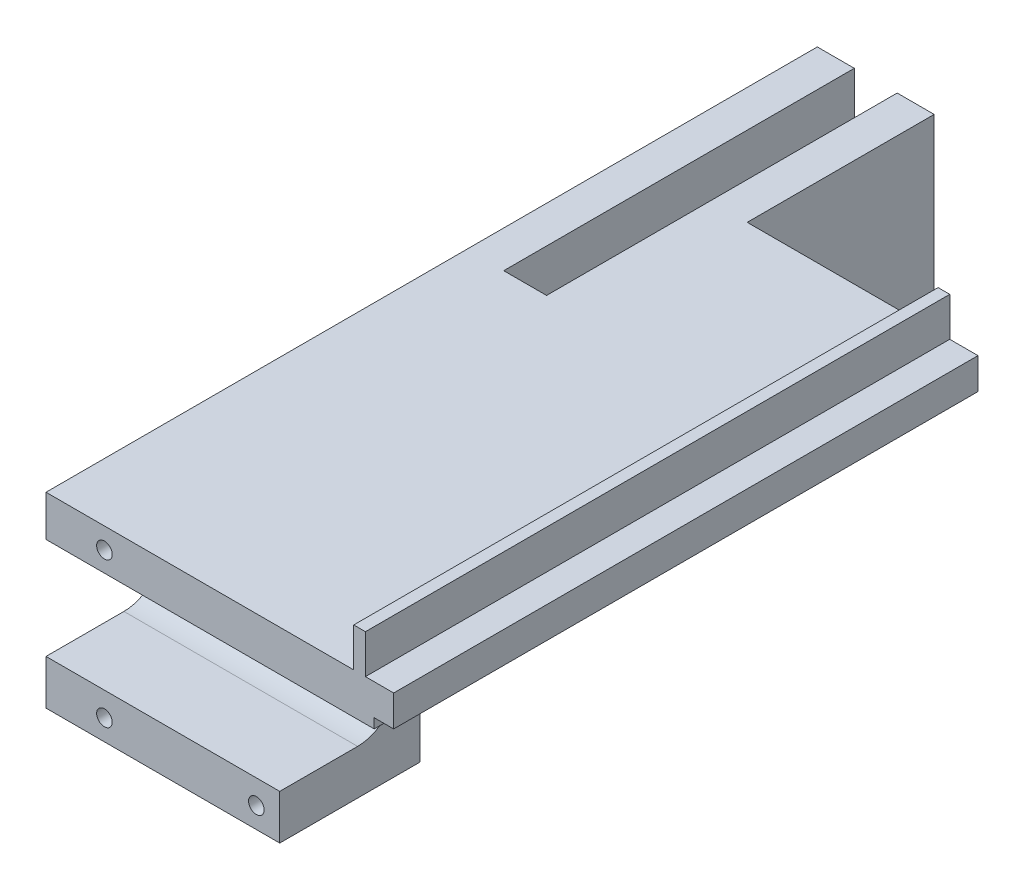
from build123d import *

# Parameters (mm, degrees)
CROQUIS1_W                 = 60
CROQUIS1_H                 = 48
SALIENTE_EXTRUIR1_DEPTH    = 6
CROQUIS4_W                 = 60
CROQUIS4_H                 = 11.5
SALIENTE_EXTRUIR3_DEPTH    = 30
CROQUIS5_R                 = 2
CORTAR_EXTRUIR3_DEPTH      = 16
CROQUIS6_W                 = 30
CROQUIS6_H                 = 48
SALIENTE_EXTRUIR4_DEPTH    = 162
CROQUIS7_R                 = 2
CORTAR_EXTRUIR4_DEPTH      = 16
CROQUIS11_W                = 150
CROQUIS11_H                = 11.5
SALIENTE_EXTRUIR6_DEPTH    = 59.25
CROQUIS12_W                = 3
CROQUIS12_H                = 150
SALIENTE_EXTRUIR7_DEPTH    = 10
CORTAR_EXTRUIR6_DEPTH      = 170.016303475
CORTAR_EXTRUIR6_DEPTH_BACK = 170.016303475
CROQUIS14_W                = 5
CROQUIS14_H                = 3.5
CORTAR_EXTRUIR7_DEPTH      = 213.768679181
CORTAR_EXTRUIR7_DEPTH_BACK = 90
CROQUIS15_W                = 11
CROQUIS15_H                = 11
CROQUIS16_W                = 30
CROQUIS16_H                = 1
CORTAR_EXTRUIR10_DEPTH     = 190.450484429
REDONDEO1_R                = 10


with BuildPart() as part:
    # Croquis1 → Saliente-Extruir1 (new body)
    with BuildSketch(Plane.XY):
        with Locations((-36.216216216, 7.011261261)):
            Rectangle(CROQUIS1_W, CROQUIS1_H)
    extrude(amount=SALIENTE_EXTRUIR1_DEPTH)

    # Croquis4 → Saliente-Extruir3 (add)
    with BuildSketch(Plane.XY.offset(6)):
        with Locations((-36.216216216, 25.261261261)):
            Rectangle(CROQUIS4_W, CROQUIS4_H)
        with Locations((-36.216216216, -11.238738739)):
            Rectangle(CROQUIS4_W, CROQUIS4_H)
    extrude(amount=SALIENTE_EXTRUIR3_DEPTH)

    # Croquis5 → Cortar-Extruir3 (cut)
    with BuildSketch(Plane.XY.offset(36)):
        with Locations((-51.216216216, 25.661261261)):
            Circle(CROQUIS5_R)
        with Locations((-12.216216216, 25.661261261)):
            Circle(CROQUIS5_R)
        with Locations((-12.216216216, -11.638738739)):
            Circle(CROQUIS5_R)
        with Locations((-51.216216216, -11.638738739)):
            Circle(CROQUIS5_R)
    extrude(amount=-CORTAR_EXTRUIR3_DEPTH, mode=Mode.SUBTRACT)

    # Croquis6 → Saliente-Extruir4 (add)
    with BuildSketch(Plane(origin=(0, 0, 0), x_dir=(-1, 0, 0), z_dir=(0, 0, -1))):
        with Locations((51.216216216, 7.011261261)):
            Rectangle(CROQUIS6_W, CROQUIS6_H)
    extrude(amount=SALIENTE_EXTRUIR4_DEPTH)

    # Croquis7 → Cortar-Extruir4 (cut)
    with BuildSketch(Plane(origin=(0, 0, -162), x_dir=(-1, 0, 0), z_dir=(0, 0, -1))):
        with Locations((51.216216216, 7.011261261)):
            Circle(CROQUIS7_R)
    extrude(amount=-CORTAR_EXTRUIR4_DEPTH, mode=Mode.SUBTRACT)

    # Croquis11 → Saliente-Extruir6 (add)
    with BuildSketch(Plane(origin=(-36.216216216, 0, 0), x_dir=(0, 0, -1), z_dir=(1, 0, 0))):
        with Locations((39, 25.261261261)):
            Rectangle(CROQUIS11_W, CROQUIS11_H)
    extrude(amount=SALIENTE_EXTRUIR6_DEPTH)

    # Croquis12 → Saliente-Extruir7 (add)
    with BuildSketch(Plane(origin=(0, 31.011261261, 0), x_dir=(1, 0, 0), z_dir=(0, 1, 0))):
        with Locations((14.283783784, 39)):
            Rectangle(CROQUIS12_W, CROQUIS12_H)
    extrude(amount=SALIENTE_EXTRUIR7_DEPTH)

    # Croquis14 → Cortar-Extruir6 (cut, two sides: drawn at the far end of the back side and taken through both)
    with BuildSketch(Plane(origin=(0, 0, -114), x_dir=(-1, 0, 0), z_dir=(0, 0, -1)).offset(-CORTAR_EXTRUIR6_DEPTH_BACK)):
        with Locations((-20.533783784, 21.261261261)):
            Rectangle(CROQUIS14_W, CROQUIS14_H)
    extrude(amount=CORTAR_EXTRUIR6_DEPTH + CORTAR_EXTRUIR6_DEPTH_BACK, mode=Mode.SUBTRACT)

    # Croquis15 → Cortar-Extruir7 (cut, two sides: drawn at the far end of the back side and taken through both)
    with BuildSketch(Plane(origin=(0, 0, -162), x_dir=(-1, 0, 0), z_dir=(0, 0, -1)).offset(-CORTAR_EXTRUIR7_DEPTH_BACK)):
        with Locations((51.216216216, 25.511261261)):
            Rectangle(CROQUIS15_W, CROQUIS15_H)
    extrude(amount=CORTAR_EXTRUIR7_DEPTH + CORTAR_EXTRUIR7_DEPTH_BACK, mode=Mode.SUBTRACT)

    # Croquis16 → Cortar-Extruir10 (cut, through all)
    with BuildSketch(Plane.ZY.offset(66.216216216)):
        with Locations((21, 20.011261261)):
            Rectangle(CROQUIS16_W, CROQUIS16_H)
    extrude(amount=-CORTAR_EXTRUIR10_DEPTH, mode=Mode.SUBTRACT)

    # Redondeo1
    redondeo1_edges = [part.edges().sort_by_distance(p)[0] for p in [
        (-36.216216216, -5.488738739, 6),
        (-24.091216216, 20.511261261, 6),
    ]]
    fillet(redondeo1_edges, radius=REDONDEO1_R)


solid = part.part
